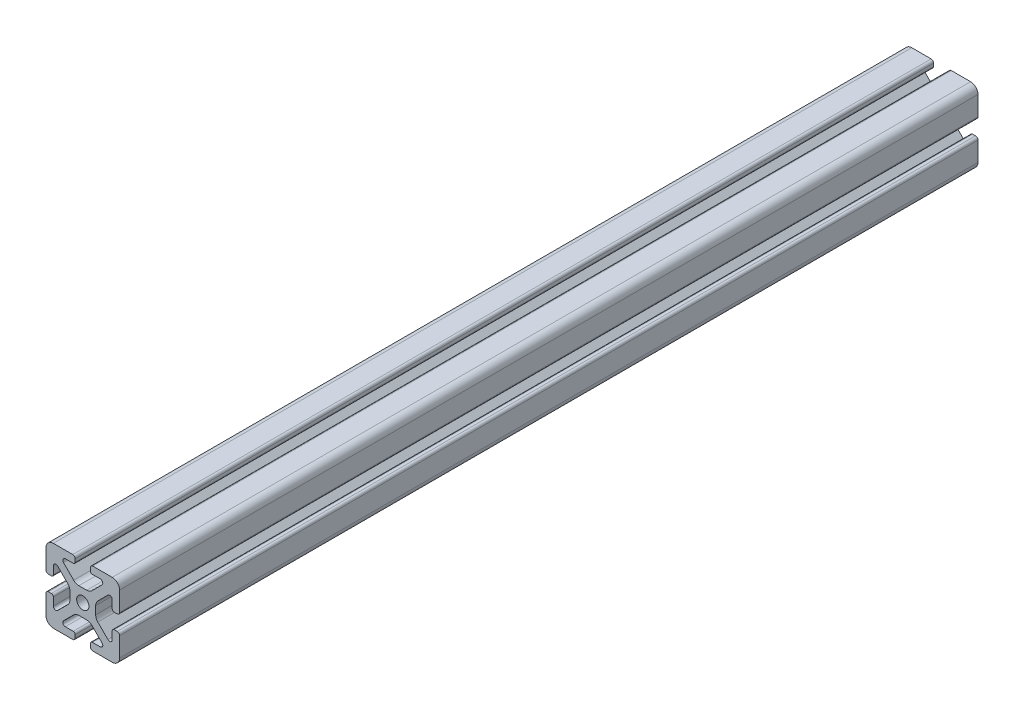
from build123d import *

# Parameters (mm, degrees)
SKETCH1_R           = 2.5
BOSS_EXTRUDE1_DEPTH = 350


with BuildPart() as part:
    # Sketch1 → Boss-Extrude1 (new body)
    with BuildSketch(Plane.XY):
        with BuildLine():
            Line((1.603196264, 5.250000001), (-1.603196256, 5.250000001))
            ThreePointArc((-1.603196256, 5.250000001), (-2.751246551, 5.478361403), (-3.724516596, 6.128679656))
            Line((-3.724516596, 6.128679656), (-7.850557356, 10.254720416))
            ThreePointArc((-7.850557356, 10.254720416), (-8.072177387, 11.368879549), (-7.127638883, 12))
            Line((-7.127638883, 12), (-3.899999993, 12))
            ThreePointArc((-3.899999993, 12), (-3.334314568, 12.234314575), (-3.099999993, 12.8))
            Line((-3.099999993, 12.8), (-3.099999993, 14))
            ThreePointArc((-3.099999993, 14), (-3.392893211, 14.707106781), (-4.099999993, 15))
            Line((-4.099999993, 15), (-11.999999993, 15))
            ThreePointArc((-11.999999993, 15), (-14.121320336, 14.121320343), (-14.999999993, 12))
            Line((-14.999999993, 12), (-14.999999993, 4.1))
            ThreePointArc((-14.999999993, 4.1), (-14.707106774, 3.392893219), (-13.999999993, 3.1))
            Line((-13.999999993, 3.1), (-12.799999993, 3.1))
            ThreePointArc((-12.799999993, 3.1), (-12.234314568, 3.334314575), (-11.999999993, 3.9))
            Line((-11.999999993, 3.9), (-11.999999993, 7.12763889))
            ThreePointArc((-11.999999993, 7.12763889), (-11.368879545, 8.072177389), (-10.254720418, 7.85055736))
            Line((-10.254720418, 7.85055736), (-6.128679658, 3.7245166))
            ThreePointArc((-6.128679658, 3.7245166), (-5.478361404, 2.751246553), (-5.250000001, 1.603196256))
            Line((-5.250000001, 1.603196256), (-5.250000001, -1.603196264))
            ThreePointArc((-5.250000001, -1.603196264), (-5.478361403, -2.751246559), (-6.128679656, -3.724516604))
            Line((-6.128679656, -3.724516604), (-10.254720416, -7.850557364))
            ThreePointArc((-10.254720416, -7.850557364), (-11.368879549, -8.072177394), (-12, -7.12763889))
            Line((-12, -7.12763889), (-12, -3.9))
            ThreePointArc((-12, -3.9), (-12.234314575, -3.334314575), (-12.8, -3.1))
            Line((-12.8, -3.1), (-14, -3.1))
            ThreePointArc((-14, -3.1), (-14.707106781, -3.392893219), (-15, -4.1))
            Line((-15, -4.1), (-15, -12))
            ThreePointArc((-15, -12), (-14.121320344, -14.121320344), (-12, -15))
            Line((-12, -15), (-4.1, -15))
            ThreePointArc((-4.1, -15), (-3.392893219, -14.707106781), (-3.1, -14))
            Line((-3.1, -14), (-3.1, -12.8))
            ThreePointArc((-3.1, -12.8), (-3.334314575, -12.234314575), (-3.9, -12))
            Line((-3.9, -12), (-7.12763889, -12))
            ThreePointArc((-7.12763889, -12), (-8.07217739, -11.368879552), (-7.85055736, -10.254720425))
            Line((-7.85055736, -10.254720425), (-3.7245166, -6.128679665))
            ThreePointArc((-3.7245166, -6.128679665), (-2.751246554, -5.478361411), (-1.603196256, -5.250000009))
            Line((-1.603196256, -5.250000009), (1.603196264, -5.250000009))
            ThreePointArc((1.603196264, -5.250000009), (2.751246559, -5.478361411), (3.724516604, -6.128679664))
            Line((3.724516604, -6.128679664), (7.850557364, -10.254720424))
            ThreePointArc((7.850557364, -10.254720424), (8.072177394, -11.368879556), (7.12763889, -12.000000007))
            Line((7.12763889, -12.000000007), (3.9, -12.000000007))
            ThreePointArc((3.9, -12.000000007), (3.334314575, -12.234314583), (3.1, -12.800000007))
            Line((3.1, -12.800000007), (3.1, -14.000000007))
            ThreePointArc((3.1, -14.000000007), (3.392893219, -14.707106789), (4.1, -15.000000007))
            Line((4.1, -15.000000007), (12, -15.000000007))
            ThreePointArc((12, -15.000000007), (14.121320343, -14.121320351), (15, -12.000000007))
            Line((15, -12.000000007), (15, -4.100000007))
            ThreePointArc((15, -4.100000007), (14.707106781, -3.392893226), (14, -3.100000007))
            Line((14, -3.100000007), (12.8, -3.100000007))
            ThreePointArc((12.8, -3.100000007), (12.234314575, -3.334314583), (12, -3.900000007))
            Line((12, -3.900000007), (12, -7.127638897))
            ThreePointArc((12, -7.127638897), (11.368879552, -8.072177397), (10.254720425, -7.850557367))
            Line((10.254720425, -7.850557367), (6.128679665, -3.724516607))
            ThreePointArc((6.128679665, -3.724516607), (5.478361411, -2.751246561), (5.250000009, -1.603196264))
            Line((5.250000009, -1.603196264), (5.250000009, 1.603196256))
            ThreePointArc((5.250000009, 1.603196256), (5.478361411, 2.751246551), (6.128679664, 3.724516596))
            Line((6.128679664, 3.724516596), (10.254720424, 7.850557356))
            ThreePointArc((10.254720424, 7.850557356), (11.368879556, 8.072177387), (12.000000007, 7.127638882))
            Line((12.000000007, 7.127638882), (12.000000007, 3.899999992))
            ThreePointArc((12.000000007, 3.899999992), (12.234314582, 3.334314567), (12.800000007, 3.099999992))
            Line((12.800000007, 3.099999992), (14.000000007, 3.099999992))
            ThreePointArc((14.000000007, 3.099999992), (14.707106788, 3.392893211), (15.000000007, 4.099999992))
            Line((15.000000007, 4.099999992), (15.000000007, 11.999999992))
            ThreePointArc((15.000000007, 11.999999992), (14.121320351, 14.121320336), (12.000000007, 14.999999992))
            Line((12.000000007, 14.999999992), (4.100000007, 14.999999992))
            ThreePointArc((4.100000007, 14.999999992), (3.392893226, 14.707106774), (3.100000007, 13.999999992))
            Line((3.100000007, 13.999999992), (3.100000007, 12.799999992))
            ThreePointArc((3.100000007, 12.799999992), (3.334314582, 12.234314567), (3.900000007, 11.999999992))
            Line((3.900000007, 11.999999992), (7.127638897, 11.999999992))
            ThreePointArc((7.127638897, 11.999999992), (8.072177397, 11.368879544), (7.850557367, 10.254720418))
            Line((7.850557367, 10.254720418), (3.724516607, 6.128679658))
            ThreePointArc((3.724516607, 6.128679658), (2.751246561, 5.478361404), (1.603196264, 5.250000001))
        make_face()
        Circle(SKETCH1_R, mode=Mode.SUBTRACT)
    extrude(amount=BOSS_EXTRUDE1_DEPTH)


solid = part.part
